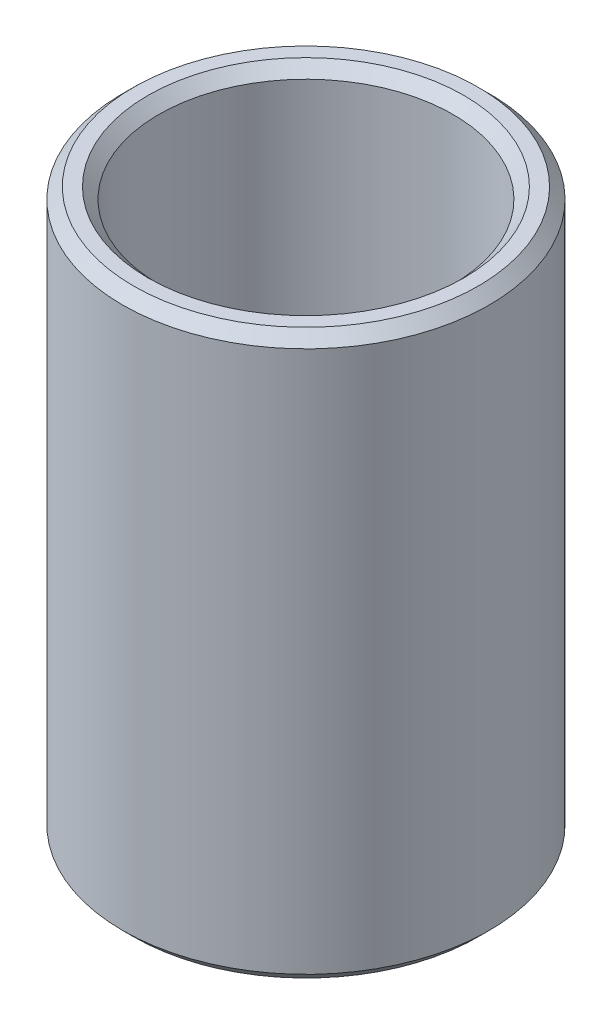
from build123d import *

# Parameters (mm, degrees)
SKETCH1_R           = 15
BOSS_EXTRUDE1_DEPTH = 46.140877221
SKETCH2_R           = 12.041294575
CUT_EXTRUDE1_DEPTH  = 51.783664211
CHAMFER1_SIZE       = 0.896203247


with BuildPart() as part:
    # Sketch1 → Boss-Extrude1 (new body)
    with BuildSketch(Plane(origin=(0, 0, 0), x_dir=(1, 0, 0), z_dir=(0, 1, 0))):
        Circle(SKETCH1_R)
    extrude(amount=BOSS_EXTRUDE1_DEPTH)

    # Sketch2 → Cut-Extrude1 (cut, through all)
    with BuildSketch(Plane(origin=(0, 0, 0), x_dir=(1, 0, 0), z_dir=(0, 1, 0))):
        Circle(SKETCH2_R)
    extrude(amount=CUT_EXTRUDE1_DEPTH, mode=Mode.SUBTRACT)

    # Chamfer1
    chamfer1_edges = [part.edges().sort_by_distance(p)[0] for p in [
        (-12.041294575, 46.140877221, 0),
        (-12.041294575, 0, 0),
        (-15, 0, 0),
        (-15, 46.140877221, 0),
    ]]
    chamfer(chamfer1_edges, length=CHAMFER1_SIZE)


solid = part.part
